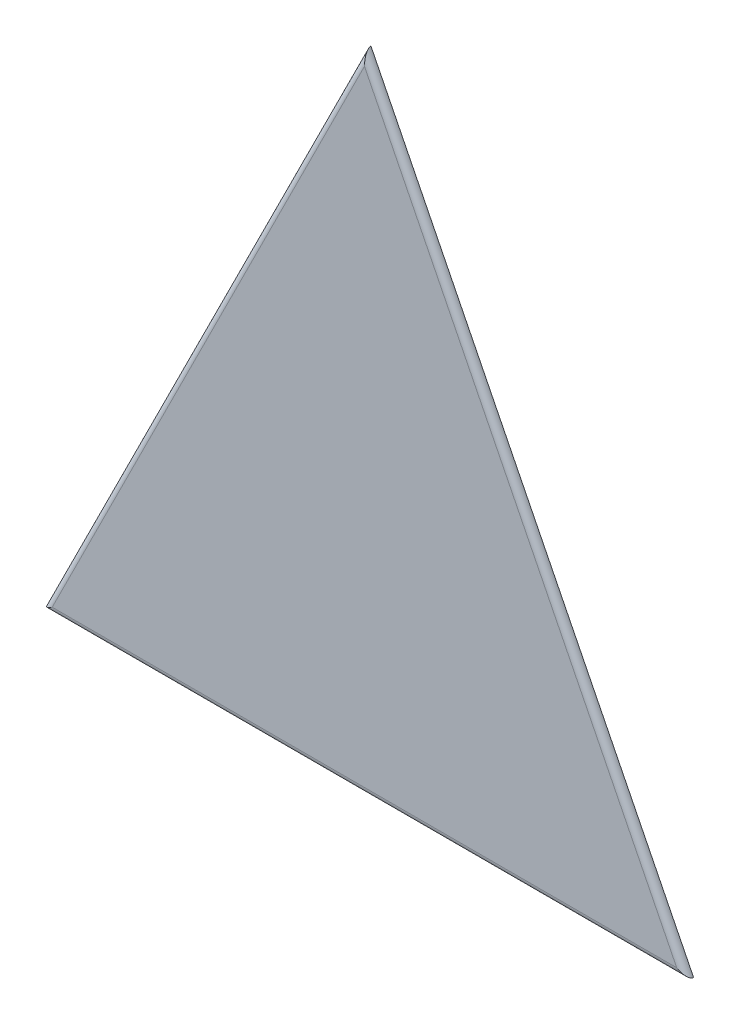
from build123d import *

# Parameters (mm, degrees)
BOSS_EXTRUDE1_DEPTH = 1
FILLET1_R           = 1


with BuildPart() as part:
    # Sketch1 → Boss-Extrude1 (new body)
    with BuildSketch(Plane.XY):
        Polygon((-50, 0), (50, 0), (0, 100), align=None)
    extrude(amount=BOSS_EXTRUDE1_DEPTH)

    # Fillet1
    fillet1_edges = [part.edges().sort_by_distance(p)[0] for p in [
        (0, 0, 1),
        (-25, 50, 1),
        (25, 50, 1),
    ]]
    fillet(fillet1_edges, radius=FILLET1_R - 0.0001)  # a hair under: the kernel refuses the full size


solid = part.part
